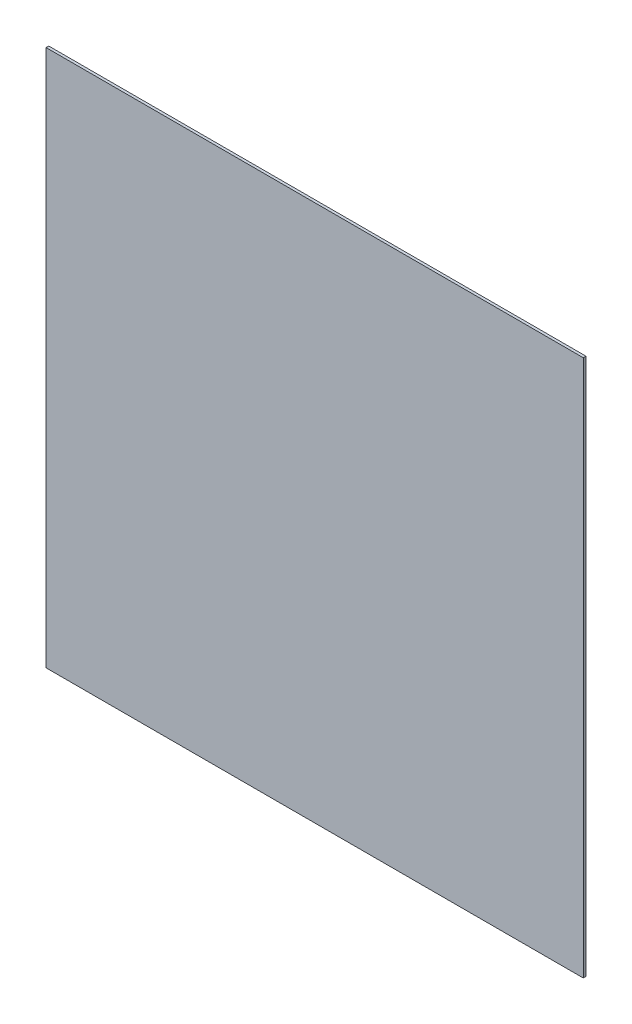
from build123d import *

# Parameters (mm, degrees)
SKETCH1_W           = 400
SKETCH1_H           = 400
BOSS_EXTRUDE1_DEPTH = 2


with BuildPart() as part:
    # Sketch1 → Boss-Extrude1 (new body)
    with BuildSketch(Plane.XY):
        Rectangle(SKETCH1_W, SKETCH1_H)
    extrude(amount=BOSS_EXTRUDE1_DEPTH)


solid = part.part
